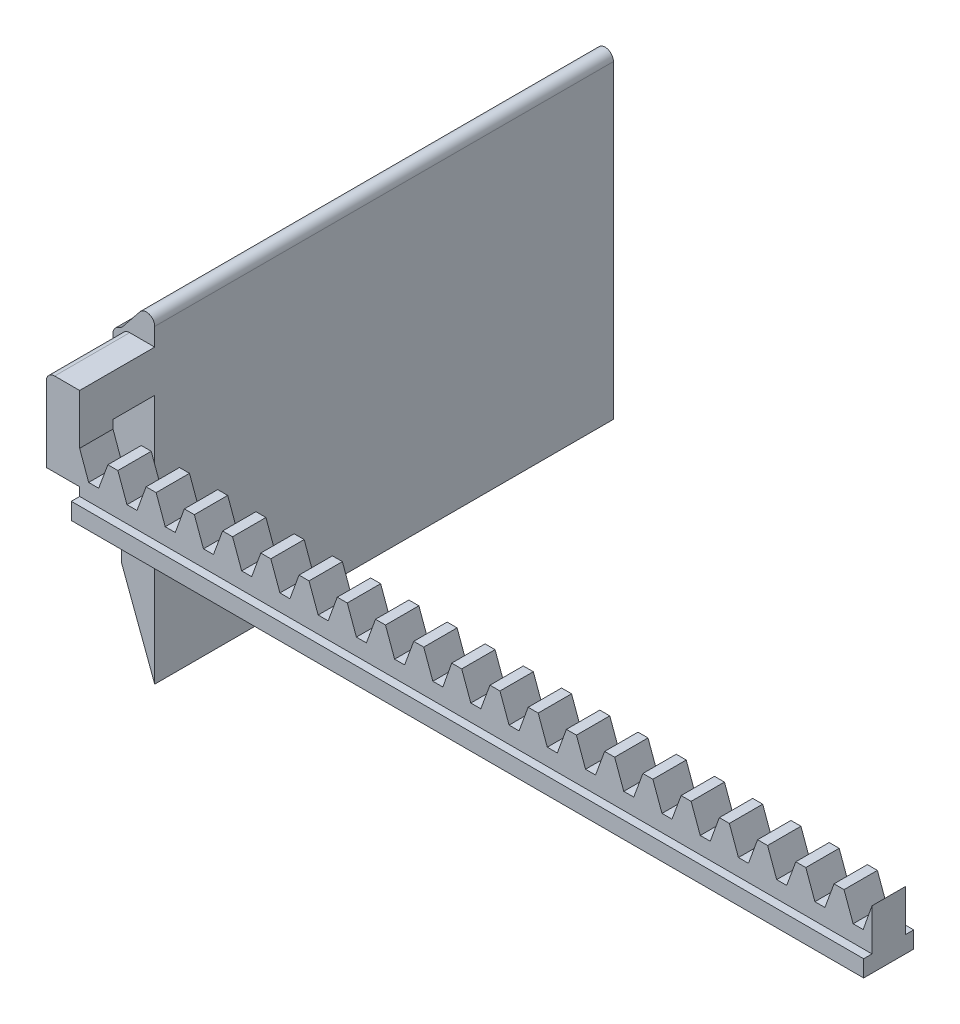
from build123d import *

# Parameters (mm, degrees)
BOSS_EXTRU_2_DEPTH      = 4
ESQUISSE5_W             = 1
ESQUISSE5_H             = 2
BOSS_EXTRU_3_DEPTH      = 95
ESQUISSE6_W             = 4
ESQUISSE6_H             = 10
BOSS_EXTRU_4_DEPTH      = 4
ESQUISSE7_W             = 10
ESQUISSE7_H             = 5
BOSS_EXTRU_5_DEPTH      = 4
BOSS_EXTRU_6_DEPTH      = 50
BOSS_EXTRU_6_DEPTH_BACK = 5
CONG_1_R                = 1
CONG_2_R                = 1


with BuildPart() as part:
    # Esquisse2 → Boss.-Extru.2 (new body)
    with BuildSketch(Plane.XY):
        Polygon((-0.6, 0), (0.6, 0), (1.691910703, 3), (2.891910703, 3), (3.983821406, 0), (5.183821406, 0), (6.275732108, 3), (7.475732108, 3), (8.567642811, 0), (9.767642811, 0), (10.859553514, 3), (12.059553514, 3), (13.151464217, 0), (14.351464217, 0), (15.44337492, 3), (16.64337492, 3), (17.735285622, 0), (18.935285622, 0), (20.027196325, 3), (21.227196325, 3), (22.319107028, 0), (23.519107028, 0), (24.611017731, 3), (25.811017731, 3), (26.902928434, 0), (28.102928434, 0), (29.194839136, 3), (30.394839136, 3), (31.486749839, 0), (32.686749839, 0), (33.778660542, 3), (34.978660542, 3), (36.070571245, 0), (37.270571245, 0), (38.362481948, 3), (39.562481948, 3), (40.65439265, 0), (41.85439265, 0), (42.946303353, 3), (44.146303353, 3), (45.238214056, 0), (46.438214056, 0), (47.5, 3.000064821), (47.5, -4), (-47.5, -4), (-47.5, 3), (-46.4210099, -0.004671254), (-45.221021012, -0.009835451), (-44.116209929, 2.985437734), (-42.916209929, 2.985437734), (-41.824299226, -0.014562266), (-40.624299226, -0.014562266), (-39.532388523, 2.985437734), (-38.332388523, 2.985437734), (-37.24047782, -0.014562266), (-36.04047782, -0.014562266), (-34.948567118, 2.985437734), (-33.748567118, 2.985437734), (-32.656656415, -0.014562266), (-31.456656415, -0.014562266), (-30.364745712, 2.985437734), (-29.164745712, 2.985437734), (-28.072835009, -0.014562266), (-26.872835009, -0.014562266), (-25.780924306, 2.985437734), (-24.580924306, 2.985437734), (-23.489013604, -0.014562266), (-22.289013604, -0.014562266), (-21.197102901, 2.985437734), (-19.997102901, 2.985437734), (-18.905192198, -0.014562266), (-17.705192198, -0.014562266), (-16.613281495, 2.985437734), (-15.413281495, 2.985437734), (-14.321370793, -0.014562266), (-13.121370793, -0.014562266), (-12.02946009, 2.985437734), (-10.82946009, 2.985437734), (-9.737549387, -0.014562266), (-8.537549387, -0.014562266), (-7.445638684, 2.985437734), (-6.245638684, 2.985437734), (-5.153727981, -0.014562266), (-3.953727981, -0.014562266), (-2.891910703, 3), (-1.691910703, 3), align=None)
    extrude(amount=-BOSS_EXTRU_2_DEPTH)

    # Esquisse5 → Boss.-Extru.3 (add)
    with BuildSketch(Plane.ZY.offset(47.5)):
        with Locations((0.5, -3)):
            Rectangle(ESQUISSE5_W, ESQUISSE5_H)
        with Locations((-4.5, -3)):
            Rectangle(ESQUISSE5_W, ESQUISSE5_H)
    extrude(amount=-BOSS_EXTRU_3_DEPTH)

    # Esquisse6 → Boss.-Extru.4 (add)
    with BuildSketch(Plane(origin=(0, 0, -4), x_dir=(-1, 0, 0), z_dir=(0, 0, -1))):
        with Locations((49.5, 4.006649999)):
            Rectangle(ESQUISSE6_W, ESQUISSE6_H)
    extrude(amount=-BOSS_EXTRU_4_DEPTH)

    # Esquisse7 → Boss.-Extru.5 (add)
    with BuildSketch(Plane.ZY.offset(51.5)):
        with Locations((-9, 6.506649999)):
            Rectangle(ESQUISSE7_W, ESQUISSE7_H)
    extrude(amount=-BOSS_EXTRU_5_DEPTH)

    # Esquisse8 → Boss.-Extru.6 (add, two sides: drawn at the far end of the back side and taken through both)
    with BuildSketch(Plane(origin=(0, 0, -14), x_dir=(-1, 0, 0), z_dir=(0, 0, -1)).offset(-BOSS_EXTRU_6_DEPTH_BACK)):
        Polygon((47.5, 14.006649999), (47.5, -25.993350001), (51.5, -15.317080155), (51.5, -8.917080155), (52.5, -6.248012693), (52.5, 8.631987307), (51.5, 9.006649999), align=None)
    extrude(amount=BOSS_EXTRU_6_DEPTH + BOSS_EXTRU_6_DEPTH_BACK)

    # Congé1
    # the kernel refuses this fillet: 1 mm, written as the material it adds along each edge
    with BuildSketch(Plane(origin=(-51.5, 9.006649999, -9), x_dir=(0.6246950475544211, 0.7808688094430328, 0), z_dir=(0, 0, -1))) as cong_1_piece_1:
        with BuildLine():
            CenterArc((CONG_1_R * 0.275456143741, -CONG_1_R), CONG_1_R, 90, 30.801092038)
            Line((-CONG_1_R * 0.236603092518, -CONG_1_R * 0.141049862587), (0, 0))
            Line((0, 0), (CONG_1_R * 0.275456143741, 0))
        make_face()
    extrude(amount=55)
    with BuildSketch(Plane(origin=(-51.5, -8.917080155, -9), x_dir=(-0.35084650222761954, 0.9364329831197985, 0), z_dir=(0, 0, -1))) as cong_1_piece_2:
        with BuildLine():
            CenterArc((CONG_1_R * 0.18118184584, -CONG_1_R), CONG_1_R, 90, 20.539099708)
            Line((-CONG_1_R * 0.169664656387, -CONG_1_R * 0.0635670168802), (0, 0))
            Line((0, 0), (CONG_1_R * 0.18118184584, 0))
        make_face()
    extrude(amount=55)
    # the kernel refuses this fillet: 1 mm, written as the material it takes off along each edge
    with BuildSketch(Plane(origin=(-47.5, 14.006649999, -71.126952648), x_dir=(0, -1, 0), z_dir=(0, 0, 1))) as cong_1_2_piece_1:
        with BuildLine():
            CenterArc((CONG_1_R * 2.85078105936, -CONG_1_R), CONG_1_R, 90, 141.340191746)
            Line((CONG_1_R * 2.2260860118, -CONG_1_R * 1.78086880944), (0, 0))
            Line((0, 0), (CONG_1_R * 2.85078105936, 0))
        make_face()
    extrude(amount=69.253905297, mode=Mode.SUBTRACT)
    with BuildSketch(Plane(origin=(-52.5, 8.631987307, -65.733048465), x_dir=(0.9364329831198017, 0.35084650222761105, 0), z_dir=(0, 0, 1))) as cong_1_2_piece_2:
        with BuildLine():
            CenterArc((CONG_1_R * 0.693219386196, -CONG_1_R), CONG_1_R, 90, 69.460900292)
            Line((-CONG_1_R * 0.243213596923, -CONG_1_R * 0.649153497772), (0, 0))
            Line((0, 0), (CONG_1_R * 0.693219386196, 0))
        make_face()
    extrude(amount=58.466096931, mode=Mode.SUBTRACT)
    with BuildSketch(Plane(origin=(-52.5, -6.248012693, -8.547045385), x_dir=(0, 1, 0), z_dir=(0, 0, -1))) as cong_1_2_piece_3:
        with BuildLine():
            CenterArc((CONG_1_R * 0.18118184584, CONG_1_R), CONG_1_R, 249.460900292, 20.539099708)
            Line((-CONG_1_R * 0.169664656387, CONG_1_R * 0.0635670168802), (0, 0))
            Line((0, 0), (CONG_1_R * 0.18118184584, 0))
        make_face()
    extrude(amount=55.905909229, mode=Mode.SUBTRACT)
    with BuildSketch(Plane(origin=(-51.5, -15.317080155, -8.547045385), x_dir=(0.35084650222762276, -0.9364329831197973, 0), z_dir=(0, 0, -1))) as cong_1_2_piece_4:
        with BuildLine():
            CenterArc((CONG_1_R * 0.18118184584, -CONG_1_R), CONG_1_R, 90, 20.539099708)
            Line((-CONG_1_R * 0.169664656387, -CONG_1_R * 0.0635670168802), (0, 0))
            Line((0, 0), (CONG_1_R * 0.18118184584, 0))
        make_face()
    extrude(amount=55.905909229, mode=Mode.SUBTRACT)

    # Congé2
    cong_2_edges = [part.edges().sort_by_distance(p)[0] for p in [
        (-51.5, 9.006649999, -4.5),
    ]]
    fillet(cong_2_edges, radius=CONG_2_R)


solid = part.part
